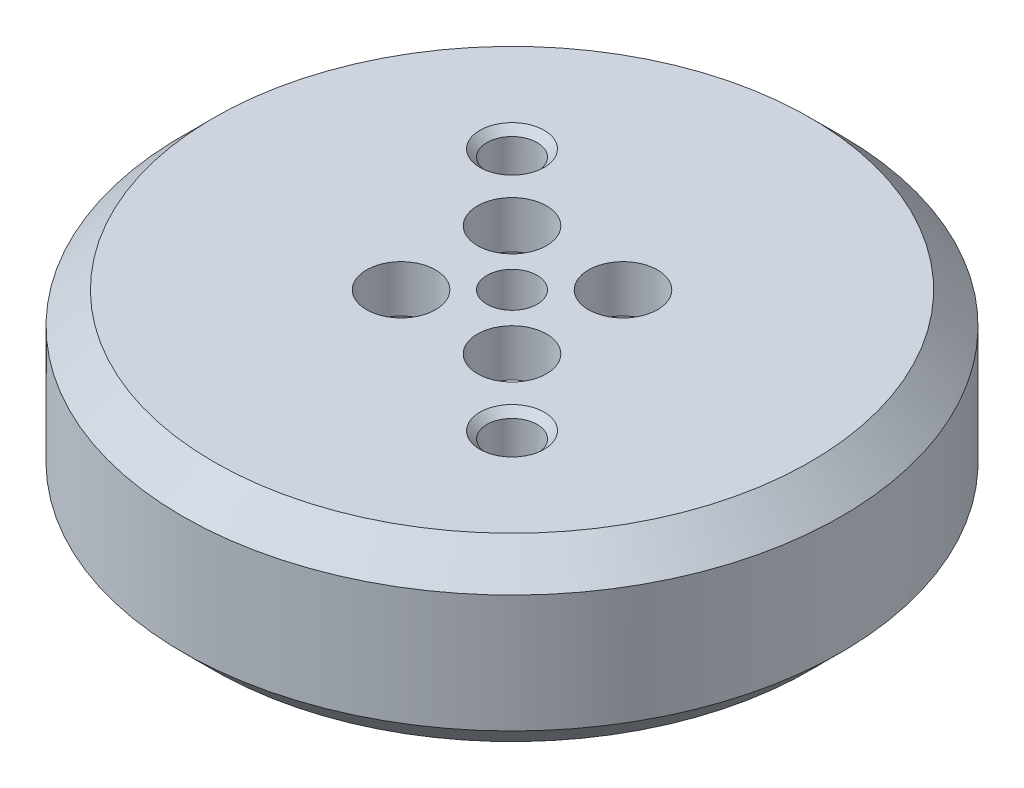
from build123d import *

# Parameters (mm, degrees)
SKETCH1_R                       = 10.5
BOSS_EXTRUDE1_DEPTH             = 1.5
CUT_EXTRUDE1_DEPTH              = 15.924811557
CUT_EXTRUDE1_DEPTH_BACK         = 15.924811557
SKETCH2_R                       = 0.8
M2_CLEARANCE_HOLE1_D            = 2.2
M2_CLEARANCE_HOLE1_DEPTH        = 5
M2_CLEARANCE_HOLE1_TIP          = 0.660946681
BOSS_EXTRUDE2_START             = 3
SKETCH7_R                       = 10.5
SKETCH7_R_2                     = 7.2
BOSS_EXTRUDE2_DEPTH             = 3
FILLET1_R                       = 1
CHAMFER1_SIZE                   = 1
CHAMFER2_SIZE                   = 1
M2X0_4_TAPPED_HOLE1_D           = 1.6
M2X0_4_TAPPED_HOLE1_DEPTH       = 5.2
M2X0_4_TAPPED_HOLE1_CSINK_D     = 2.05
M2X0_4_TAPPED_HOLE1_CSINK_ANGLE = 90
M2X0_4_TAPPED_HOLE1_TIP         = 0.480688495


with BuildPart() as part:
    # Sketch1 → Boss-Extrude1 (new body)
    with BuildSketch(Plane(origin=(0, 0, 0), x_dir=(1, 0, 0), z_dir=(0, 1, 0))):
        Circle(SKETCH1_R)
    extrude(amount=BOSS_EXTRUDE1_DEPTH)

    # Sketch2 → Cut-Extrude1 (cut, two sides: drawn at the far end of the back side and taken through both)
    with BuildSketch(Plane(origin=(0, 1.5, 0), x_dir=(1, 0, 0), z_dir=(0, 1, 0)).offset(-CUT_EXTRUDE1_DEPTH_BACK)):
        Circle(SKETCH2_R)
    extrude(amount=CUT_EXTRUDE1_DEPTH + CUT_EXTRUDE1_DEPTH_BACK, mode=Mode.SUBTRACT)

    # M2 Clearance Hole1
    with Locations(Plane(origin=(0, 1.5, 0), x_dir=(1, 0, 0), z_dir=(0, 1, 0))):
        with Locations((-1.767766953, 1.767766953), (1.767766953, 1.767766953), (1.767766953, -1.767766953), (-1.767766953, -1.767766953)):
            Hole(M2_CLEARANCE_HOLE1_D / 2, depth=M2_CLEARANCE_HOLE1_DEPTH)
            with Locations((0, 0, -(M2_CLEARANCE_HOLE1_DEPTH + M2_CLEARANCE_HOLE1_TIP / 2))):  # 118° drill point
                Cone(0, M2_CLEARANCE_HOLE1_D / 2, M2_CLEARANCE_HOLE1_TIP, mode=Mode.SUBTRACT)

    # Sketch6 → Revolve1 (revolve)
    with BuildSketch(Plane.XY):
        Polygon((-10.5, 0), (-10.5, -1.25), (-7.2, -1.25), (-5, 0), align=None)
    revolve(axis=Axis((0, 0, 0), (0, -1, 0)))

    # Sketch7 → Boss-Extrude2 (add)
    with BuildSketch(Plane.XZ.offset(1.25).offset(BOSS_EXTRUDE2_START)):
        Circle(SKETCH7_R)
        Circle(SKETCH7_R_2, mode=Mode.SUBTRACT)
    extrude(amount=-BOSS_EXTRUDE2_DEPTH)

    # Fillet1
    fillet1_edges = [part.edges().sort_by_distance(p)[0] for p in [
        (5, 0, 0),
        (0, -1.25, 7.2),
    ]]
    fillet(fillet1_edges, radius=FILLET1_R)

    # Chamfer1
    chamfer1_edges = [part.edges().sort_by_distance(p)[0] for p in [
        (-10.5, 1.5, 0),
    ]]
    chamfer(chamfer1_edges, length=CHAMFER1_SIZE)

    # Chamfer2
    chamfer2_edges = [part.edges().sort_by_distance(p)[0] for p in [
        (-10.5, -4.25, 0),
    ]]
    chamfer(chamfer2_edges, length=CHAMFER2_SIZE)

    # M2x0.4 Tapped Hole1
    with Locations(Plane(origin=(0, 1.5, 0), x_dir=(1, 0, 0), z_dir=(0, 1, 0))):
        with Locations((-3.889087297, 3.889087297), (3.889087297, -3.889087297), (-1.767766953, 1.767766953)):
            CounterSinkHole(M2X0_4_TAPPED_HOLE1_D / 2, M2X0_4_TAPPED_HOLE1_CSINK_D / 2, depth=M2X0_4_TAPPED_HOLE1_DEPTH, counter_sink_angle=M2X0_4_TAPPED_HOLE1_CSINK_ANGLE)
            with Locations((0, 0, -(M2X0_4_TAPPED_HOLE1_DEPTH + M2X0_4_TAPPED_HOLE1_TIP / 2))):  # 118° drill point
                Cone(0, M2X0_4_TAPPED_HOLE1_D / 2, M2X0_4_TAPPED_HOLE1_TIP, mode=Mode.SUBTRACT)


solid = part.part
